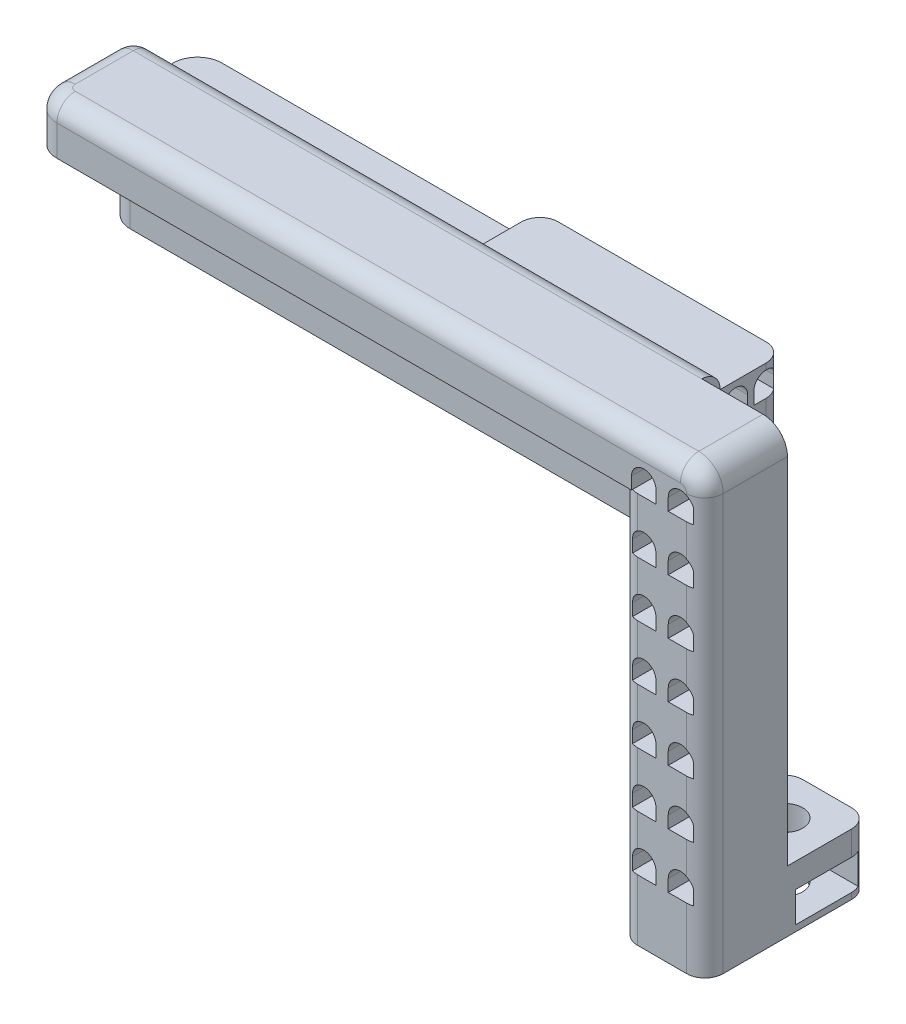
from build123d import *

# Parameters (mm, degrees)
SKETCH1_W            = 55
SKETCH1_H            = 16
BOSS_EXTRUDE1_DEPTH  = 4
SKETCH2_W            = 50
SKETCH2_H            = 8
BOSS_EXTRUDE2_DEPTH  = 8
SKETCH3_W            = 5
SKETCH3_H            = 16
BOSS_EXTRUDE3_DEPTH  = 28
SKETCH4_R            = 1.45
CUT_EXTRUDE2_DEPTH   = 10
CUT_EXTRUDE4_START   = -3
CUT_EXTRUDE4_DEPTH   = 3
CUT_EXTRUDE5_DEPTH   = 5
SKETCH8_W            = 50
SKETCH8_H            = 2
CUT_EXTRUDE6_DEPTH   = 4
CUT_EXTRUDE7_START   = -50
SKETCH9_W            = 0.5
SKETCH9_H            = 8
CUT_EXTRUDE7_DEPTH   = 50
CUT_EXTRUDE8_START   = -55
SKETCH10_W           = 0.5
SKETCH10_H           = 32
CUT_EXTRUDE8_DEPTH   = 55
CUT_EXTRUDE9_DEPTH   = 3
CUT_EXTRUDE11_DEPTH  = 3
BOSS_EXTRUDE4_START  = 2
SKETCH17_W           = 15
SKETCH17_H           = 32
BOSS_EXTRUDE4_DEPTH  = 2
SKETCH18_W           = 7
SKETCH18_H           = 1.5
CUT_EXTRUDE12_DEPTH  = 32
FILLET1_R            = 2
SKETCH19_W           = 13.5
SKETCH19_H           = 32
CUT_EXTRUDE13_DEPTH  = 7
SKETCH20_W           = 7
SKETCH20_H           = 13.5
BOSS_EXTRUDE5_DEPTH  = 40
CUT_EXTRUDE14_DEPTH  = 13.5
FILLET2_R            = 2
CUT_EXTRUDE15_REACH  = 69.209
SKETCH22_W           = 6.75
SKETCH22_H           = 40
LPATTERN1_COUNT      = 7
LPATTERN1_PITCH      = 4.5
SKETCH23_W           = 5.25
SKETCH23_H           = 4
CUT_EXTRUDE16_DEPTH  = 48
BOSS_EXTRUDE9_START  = -27
SKETCH29_W           = 7
SKETCH29_H           = 6.75
SKETCH29_R           = 1.45
BOSS_EXTRUDE9_DEPTH  = 5
CUT_EXTRUDE19_START  = -2
CUT_EXTRUDE19_DEPTH  = 2.5
BOSS_EXTRUDE11_DEPTH = 20
SKETCH35_W           = 7
SKETCH35_H           = 4
CUT_EXTRUDE20_DEPTH  = 6.75
FILLET3_R            = 1.5


# Read off the part's stored shape, not the designer's step: Cut-Extrude4
with BuildPart() as part:
    # Sketch1 → Boss-Extrude1 (new body)
    with BuildSketch(Plane(origin=(0, 0, 0), x_dir=(1, 0, 0), z_dir=(0, 1, 0))):
        with Locations((27.5, 8)):
            Rectangle(SKETCH1_W, SKETCH1_H)
    extrude(amount=BOSS_EXTRUDE1_DEPTH)

    # Sketch2 → Boss-Extrude2 (add)
    with BuildSketch(Plane.XZ):
        with Locations((25, -10)):
            Rectangle(SKETCH2_W, SKETCH2_H)
    extrude(amount=BOSS_EXTRUDE2_DEPTH)

    # Sketch3 → Boss-Extrude3 (add)
    with BuildSketch(Plane.XZ):
        with Locations((52.5, -8)):
            Rectangle(SKETCH3_W, SKETCH3_H)
    extrude(amount=BOSS_EXTRUDE3_DEPTH)

    # Sketch4 → Cut-Extrude2 (cut)
    with BuildSketch(Plane.XY.offset(-6)):
        with Locations((10, -4)):
            Circle(SKETCH4_R)
        with Locations((20, -4)):
            Circle(SKETCH4_R)
        with Locations((30, -4)):
            Circle(SKETCH4_R)
        with Locations((40, -4)):
            Circle(SKETCH4_R)
    extrude(amount=-CUT_EXTRUDE2_DEPTH, mode=Mode.SUBTRACT)

    # Cut-Extrude4 outline → Cut-Extrude4 (cut)
    with BuildSketch(Plane.ZY.offset(-50).offset(CUT_EXTRUDE4_START)):
        Polygon((-6.598076211, -25.5), (-4, -27), (-1.401923789, -25.5), (-1.401923789, 0), (-6, 0), (-6, -8), (-6.598076211, -8), align=None)
        Polygon((-7.401923789, -25.5), (-7.401923789, -8), (-12.598076211, -8), (-12.598076211, -25.5), (-10, -27), align=None)
    extrude(amount=CUT_EXTRUDE4_DEPTH, mode=Mode.SUBTRACT)

    # Sketch7 → Cut-Extrude5 (cut)
    with BuildSketch(Plane.ZY.offset(-50)):
        with BuildLine():
            Line((-11.45, -12), (-11.45, -24))
            ThreePointArc((-11.45, -24), (-10, -25.45), (-8.55, -24))
            Line((-8.55, -24), (-8.55, -12))
            ThreePointArc((-8.55, -12), (-10, -10.55), (-11.45, -12))
        make_face()
        with BuildLine():
            Line((-2.55, -12), (-2.55, -24))
            ThreePointArc((-2.55, -24), (-4, -25.45), (-5.45, -24))
            Line((-5.45, -24), (-5.45, -12))
            ThreePointArc((-5.45, -12), (-4, -10.55), (-2.55, -12))
        make_face()
    extrude(amount=-CUT_EXTRUDE5_DEPTH, mode=Mode.SUBTRACT)

    # Sketch8 → Cut-Extrude6 (cut)
    with BuildSketch(Plane(origin=(0, 4, 0), x_dir=(1, 0, 0), z_dir=(0, 1, 0))):
        with Locations((25, 15)):
            Rectangle(SKETCH8_W, SKETCH8_H)
    extrude(amount=-CUT_EXTRUDE6_DEPTH, mode=Mode.SUBTRACT)

    # Sketch9 → Cut-Extrude7 (cut)
    with BuildSketch(Plane.ZY.offset(CUT_EXTRUDE7_START)):
        with Locations((-6.25, -4)):
            Rectangle(SKETCH9_W, SKETCH9_H)
    extrude(amount=CUT_EXTRUDE7_DEPTH, mode=Mode.SUBTRACT)

    # Sketch10 → Cut-Extrude8 (cut)
    with BuildSketch(Plane.ZY.offset(CUT_EXTRUDE8_START)):
        with Locations((-0.25, -12)):
            Rectangle(SKETCH10_W, SKETCH10_H)
        with Locations((-15.75, -12)):
            Rectangle(SKETCH10_W, SKETCH10_H)
    extrude(amount=CUT_EXTRUDE8_DEPTH, mode=Mode.SUBTRACT)

    # Sketch11 → Cut-Extrude9 (cut)
    with BuildSketch(Plane(origin=(0, 0, -14), x_dir=(-1, 0, 0), z_dir=(0, 0, -1))):
        Polygon((-37, -4), (-38.5, -1.401923789), (-41.5, -1.401923789), (-43, -4), (-41.5, -6.598076211), (-38.5, -6.598076211), align=None)
        Polygon((-27, -4), (-28.5, -1.401923789), (-31.5, -1.401923789), (-33, -4), (-31.5, -6.598076211), (-28.5, -6.598076211), align=None)
        Polygon((-17, -4), (-18.5, -1.401923789), (-21.5, -1.401923789), (-23, -4), (-21.5, -6.598076211), (-18.5, -6.598076211), align=None)
        Polygon((-7, -4), (-8.5, -1.401923789), (-11.5, -1.401923789), (-13, -4), (-11.5, -6.598076211), (-8.5, -6.598076211), align=None)
    extrude(amount=-CUT_EXTRUDE9_DEPTH, mode=Mode.SUBTRACT)

    # Sketch15 → Cut-Extrude11 (cut)
    with BuildSketch(Plane.ZY.offset(-50)):
        Polygon((-4, -27), (-1.401923789, -25.5), (-1.401923789, 0.004821093), (-1.401923789, 4), (-6.598076211, 4), (-6.598076211, -8), (-6.598076211, -25.5), align=None)
        Polygon((-7.401923789, -25.5), (-7.401923789, -8), (-7.401923789, 4), (-12.598076211, 4), (-12.598076211, -8), (-12.598076211, -25.5), (-10, -27), align=None)
    extrude(amount=-CUT_EXTRUDE11_DEPTH, mode=Mode.SUBTRACT)

    # Sketch17 → Boss-Extrude4 (add)
    with BuildSketch(Plane.ZY.offset(-50).offset(BOSS_EXTRUDE4_START)):
        with Locations((-8, -12)):
            Rectangle(SKETCH17_W, SKETCH17_H)
        with BuildLine():
            Line((-11.45, -12), (-11.45, -24))
            ThreePointArc((-11.45, -24), (-10, -25.45), (-8.55, -24))
            Line((-8.55, -24), (-8.55, -12))
            ThreePointArc((-8.55, -12), (-10, -10.55), (-11.45, -12))
        make_face(mode=Mode.SUBTRACT)
        with BuildLine():
            Line((-5.45, -12), (-5.45, -24))
            ThreePointArc((-5.45, -24), (-4, -25.45), (-2.55, -24))
            Line((-2.55, -24), (-2.55, -12))
            ThreePointArc((-2.55, -12), (-4, -10.55), (-5.45, -12))
        make_face(mode=Mode.SUBTRACT)
    extrude(amount=-BOSS_EXTRUDE4_DEPTH)

    # Sketch18 → Cut-Extrude12 (cut)
    with BuildSketch(Plane(origin=(0, 4, 0), x_dir=(1, 0, 0), z_dir=(0, 1, 0))):
        with Locations((51.5, 14.75)):
            Rectangle(SKETCH18_W, SKETCH18_H)
    extrude(amount=-CUT_EXTRUDE12_DEPTH, mode=Mode.SUBTRACT)

    # Fillet1
    fillet1_edges = [part.edges().sort_by_distance(p)[0] for p in [
        (0, -2, -14),
        (0, -4, -6.5),
        (0, 2, -0.5),
        (55, -12, -0.5),
        (48, -14, -0.5),
        (55, -12, -14),
        (48, -18, -14),
    ]]
    fillet(fillet1_edges, radius=FILLET1_R)

    # Sketch19 → Cut-Extrude13 (cut)
    with BuildSketch(Plane(origin=(55, 0, 0), x_dir=(0, 0, -1), z_dir=(1, 0, 0))):
        with Locations((7.25, -12)):
            Rectangle(SKETCH19_W, SKETCH19_H)
    extrude(amount=-CUT_EXTRUDE13_DEPTH, mode=Mode.SUBTRACT)

    # Sketch20 → Boss-Extrude5 (add)
    with BuildSketch(Plane(origin=(0, 4, 0), x_dir=(1, 0, 0), z_dir=(0, 1, 0))):
        with Locations((51.5, 7.25)):
            Rectangle(SKETCH20_W, SKETCH20_H)
    extrude(amount=-BOSS_EXTRUDE5_DEPTH)

    # Sketch21 → Cut-Extrude14 (cut)
    with BuildSketch(Plane.XY.offset(-0.5)):
        with BuildLine():
            Line((52, 1), (52, 0))
            Line((52, 0), (54, 0))
            Line((54, 0), (54, 1))
            ThreePointArc((54, 1), (53.707106781, 1.707106781), (53, 2))
            ThreePointArc((53, 2), (52.292893219, 1.707106781), (52, 1))
        make_face()
        with BuildLine():
            Line((49, 1), (49, 0))
            Line((49, 0), (51, 0))
            Line((51, 0), (51, 1))
            ThreePointArc((51, 1), (50, 2), (49, 1))
        make_face()
    cut_extrude14 = extrude(amount=-CUT_EXTRUDE14_DEPTH, mode=Mode.SUBTRACT)

    # Fillet2
    fillet2_edges = [part.edges().sort_by_distance(p)[0] for p in [
        (48, -36, -7.25),
        (55, -36, -7.25),
        (55, 4, -7.25),
    ]]
    fillet(fillet2_edges, radius=FILLET2_R)

    # Cut-Extrude15: up to this face of the body (flat: up to its plane)
    cut_extrude15_end = Plane(part.part.faces().sort_by_distance((48, -18.954887218, -6.79887218))[0])
    # Sketch22 → Cut-Extrude15 (cut, up to the picked face)
    with BuildSketch(Plane(origin=(55, 0, 0), x_dir=(0, 0, -1), z_dir=(1, 0, 0)), mode=Mode.PRIVATE) as cut_extrude15_sk1:
        with Locations((10.625, -16)):
            Rectangle(SKETCH22_W, SKETCH22_H)
    cut_extrude15_tool1 = split(extrude(cut_extrude15_sk1.sketch, amount=-CUT_EXTRUDE15_REACH, mode=Mode.PRIVATE), bisect_by=cut_extrude15_end, keep=Keep.BOTH, mode=Mode.PRIVATE)
    add(cut_extrude15_tool1.solids().sort_by(Axis((55, -16, -10.625), (-1, 0, 0)))[0], mode=Mode.SUBTRACT)

    # LPattern1: Cut-Extrude14 ×7
    with Locations(*[(0, -i * LPATTERN1_PITCH, 0) for i in range(1, LPATTERN1_COUNT)]):
        add(cut_extrude14, mode=Mode.SUBTRACT)

    # Sketch23 → Cut-Extrude16 (cut)
    with BuildSketch(Plane(origin=(48, 0, 0), x_dir=(0, 0, -1), z_dir=(1, 0, 0))):
        with Locations((11.375, 2)):
            Rectangle(SKETCH23_W, SKETCH23_H)
    extrude(amount=-CUT_EXTRUDE16_DEPTH, mode=Mode.SUBTRACT)

    # Sketch29 → Boss-Extrude9 (add)
    with BuildSketch(Plane(origin=(0, 0, 0), x_dir=(1, 0, 0), z_dir=(0, 1, 0)).offset(BOSS_EXTRUDE9_START)):
        with Locations((51.5, 10.625)):
            Rectangle(SKETCH29_W, SKETCH29_H)
        with Locations(Location((51.5, 10.55, 0), (0, 0, 270))):
            Circle(SKETCH29_R, mode=Mode.SUBTRACT)
    extrude(amount=-BOSS_EXTRUDE9_DEPTH)

    # Sketch30 → Cut-Extrude19 (cut)
    with BuildSketch(Plane(origin=(0, -27, 0), x_dir=(1, 0, 0), z_dir=(0, 1, 0)).offset(CUT_EXTRUDE19_START)):
        Polygon((53.029978213, 13.2), (49.970021787, 13.2), (48.440043573, 10.55), (49.970021787, 7.9), (53.029978213, 7.9), (55, 7.9), (55, 13.2), align=None)
    extrude(amount=-CUT_EXTRUDE19_DEPTH, mode=Mode.SUBTRACT)

    # Sketch34 → Boss-Extrude11 (add)
    with BuildSketch(Plane(origin=(48, 0, 0), x_dir=(0, 0, -1), z_dir=(1, 0, 0))):
        with BuildLine():
            Line((14, 0), (13.5, 0))
            Line((13.5, 0), (13.5, 1))
            ThreePointArc((13.5, 1), (12.5, 2), (11.5, 1))
            Line((11.5, 1), (11.5, 0))
            Line((11.5, 0), (11, 0))
            Line((11, 0), (11, 1))
            ThreePointArc((11, 1), (10, 2), (9, 1))
            Line((9, 1), (9, 0))
            Line((9, 0), (7.25, 0))
            Line((7.25, 0), (7.25, 2.5))
            Line((7.25, 2.5), (9.593136263, 2.5))
            Line((9.593136263, 2.5), (14, 2.5))
            Line((14, 2.5), (14, 0))
        make_face()
    extrude(amount=-BOSS_EXTRUDE11_DEPTH)

    # Sketch35 → Cut-Extrude20 (cut)
    with BuildSketch(Plane.XY.offset(-0.5)):
        with Locations((51.5, -34)):
            Rectangle(SKETCH35_W, SKETCH35_H)
    extrude(amount=-CUT_EXTRUDE20_DEPTH, mode=Mode.SUBTRACT)

    # Fillet3
    # the kernel refuses this fillet: 1.5 mm, written as the material it takes off along each edge
    with BuildSketch(Plane(origin=(1.5, 2.5, -7.25), x_dir=(0, 0, -1), z_dir=(0, 1, 0))) as fillet3_piece_1_section:
        Polygon((0, 0), (FILLET3_R, 0), (FILLET3_R, FILLET3_R), (0, FILLET3_R), align=None)
    fillet3_piece_1 = extrude(amount=FILLET3_R, mode=Mode.PRIVATE)
    fillet3_piece_1 = fillet3_piece_1 - Plane(origin=(1.5, 2.5, -7.25), x_dir=(0.7071067811865475, 0, 0.7071067811865475), z_dir=(0, 1, 0)) * Sphere(FILLET3_R, mode=Mode.PRIVATE)
    add(fillet3_piece_1, mode=Mode.SUBTRACT)
    with BuildSketch(Plane(origin=(0, 4, -7.25), x_dir=(1, 0, 0), z_dir=(0, 0, 1))) as fillet3_piece_2:
        with BuildLine():
            CenterArc((FILLET3_R, -FILLET3_R), FILLET3_R, 90, 90)
            Line((0, -FILLET3_R), (0, 0))
            Line((0, 0), (FILLET3_R, 0))
        make_face()
    extrude(amount=4.75, mode=Mode.SUBTRACT)
    with BuildSketch(Plane(origin=(2, 4, -2.5), x_dir=(-1, 0, 0), z_dir=(0, 0, -1))) as fillet3_piece_3:
        with BuildLine():
            CenterArc((2 - FILLET3_R, -FILLET3_R), FILLET3_R, 0, 90)
            Line((2, -FILLET3_R), (2, 0))
            Line((2, 0), (2 - FILLET3_R, 0))
        make_face()
    revolve(axis=Axis((2, 4, -2.5), (0, 1, 0)), revolution_arc=90, mode=Mode.SUBTRACT)
    with BuildSketch(Plane(origin=(2, 4, -0.5), x_dir=(0, 0, -1), z_dir=(1, 0, 0))) as fillet3_piece_4:
        with BuildLine():
            CenterArc((FILLET3_R, -FILLET3_R), FILLET3_R, 90, 90)
            Line((0, -FILLET3_R), (0, 0))
            Line((0, 0), (FILLET3_R, 0))
        make_face()
    extrude(amount=51, mode=Mode.SUBTRACT)
    with BuildSketch(Plane(origin=(53, 2, -0.5), x_dir=(0, 1, 0), z_dir=(-1, 0, 0))) as fillet3_piece_5:
        with BuildLine():
            CenterArc((2 - FILLET3_R, FILLET3_R), FILLET3_R, 270, 90)
            Line((2 - FILLET3_R, 0), (2, 0))
            Line((2, 0), (2, FILLET3_R))
        make_face()
    revolve(axis=Axis((53, 2, -0.5), (0, 0, -1)), revolution_arc=90, mode=Mode.SUBTRACT)
    with BuildSketch(Plane(origin=(48, -11.75, -14), x_dir=(-1, 0, 0), z_dir=(0, 1, 0))) as fillet3_piece_6:
        with BuildLine():
            CenterArc((FILLET3_R, FILLET3_R), FILLET3_R, 180, 90)
            Line((0, FILLET3_R), (0, 0))
            Line((0, 0), (FILLET3_R, 0))
        make_face()
    extrude(amount=18, mode=Mode.SUBTRACT)
    with BuildSketch(Plane(origin=(48, -23.25, -14), x_dir=(0, 0, 1), z_dir=(0, -1, 0))) as fillet3_piece_7:
        with BuildLine():
            CenterArc((FILLET3_R, -FILLET3_R), FILLET3_R, 90, 90)
            Line((0, -FILLET3_R), (0, 0))
            Line((0, 0), (FILLET3_R, 0))
        make_face()
    extrude(amount=12.5, mode=Mode.SUBTRACT)
    with BuildSketch(Plane(origin=(55, -23.25, -14), x_dir=(0, 0, 1), z_dir=(0, -1, 0))) as fillet3_piece_8:
        with BuildLine():
            CenterArc((FILLET3_R, FILLET3_R), FILLET3_R, 180, 90)
            Line((0, FILLET3_R), (0, 0))
            Line((0, 0), (FILLET3_R, 0))
        make_face()
    extrude(amount=12.5, mode=Mode.SUBTRACT)
    with BuildSketch(Plane(origin=(55, 2, -0.5), x_dir=(0, 0, -1), z_dir=(0, -1, 0))) as fillet3_piece_9:
        with BuildLine():
            CenterArc((FILLET3_R, -FILLET3_R), FILLET3_R, 90, 90)
            Line((0, -FILLET3_R), (0, 0))
            Line((0, 0), (FILLET3_R, 0))
        make_face()
    extrude(amount=37.75, mode=Mode.SUBTRACT)
    with BuildSketch(Plane(origin=(28, 6.25, -14), x_dir=(1, 0, 0), z_dir=(0, -1, 0))) as fillet3_piece_10:
        with BuildLine():
            CenterArc((FILLET3_R, FILLET3_R), FILLET3_R, 180, 90)
            Line((0, FILLET3_R), (0, 0))
            Line((0, 0), (FILLET3_R, 0))
        make_face()
    extrude(amount=6.25, mode=Mode.SUBTRACT)
    with BuildSketch(Plane(origin=(51.75, 4, -8.75), x_dir=(0, 0, 1), z_dir=(-1, 0, 0))) as fillet3_piece_11:
        with BuildLine():
            CenterArc((FILLET3_R, -FILLET3_R), FILLET3_R, 90, 90)
            Line((0, -FILLET3_R), (0, 0))
            Line((0, 0), (FILLET3_R, 0))
        make_face()
    extrude(amount=50.25, mode=Mode.SUBTRACT)
    with BuildSketch(Plane(origin=(0, 0, -8.75), x_dir=(1, 0, 0), z_dir=(0, 1, 0))) as fillet3_piece_12:
        with BuildLine():
            CenterArc((FILLET3_R, -FILLET3_R), FILLET3_R, 90, 90)
            Line((0, -FILLET3_R), (0, 0))
            Line((0, 0), (FILLET3_R, 0))
        make_face()
    extrude(amount=2.5, mode=Mode.SUBTRACT)
    with BuildSketch(Plane(origin=(48, 0, -0.5), x_dir=(0, 0, -1), z_dir=(0, -1, 0))) as fillet3_piece_13:
        with BuildLine():
            CenterArc((FILLET3_R, FILLET3_R), FILLET3_R, 180, 90)
            Line((0, FILLET3_R), (0, 0))
            Line((0, 0), (FILLET3_R, 0))
        make_face()
    extrude(amount=35.75, mode=Mode.SUBTRACT)


solid = part.part
